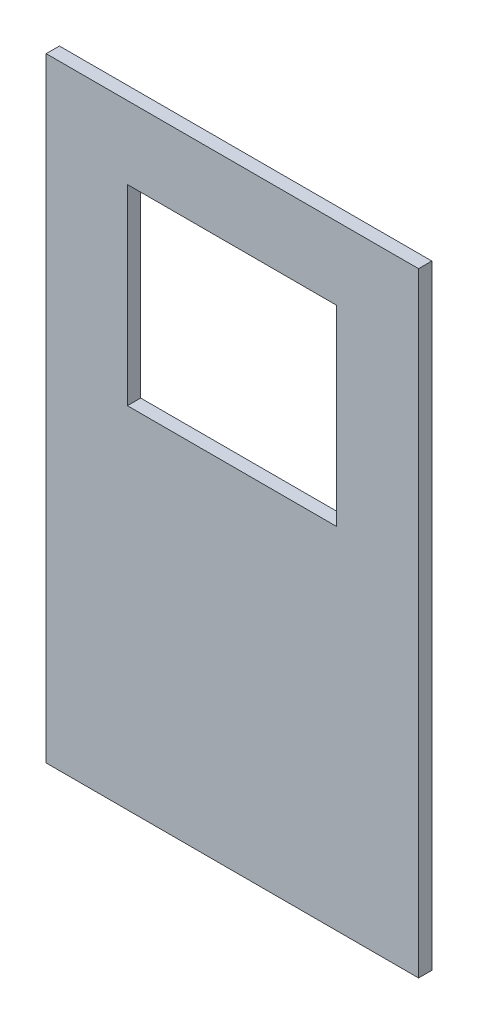
from build123d import *

# Parameters (mm, degrees)
SKETCH1_6_W   = 50.090098238
SKETCH1_6_H   = 45.932062837
SKETCH1_6_R   = 4.5
BEZEL_DEPTH   = 3.18
SKETCH1_7_W   = 89.29
SKETCH1_7_H   = 147.294272307
SKETCH1_7_R   = 3.6
SKETCH1_7_R_2 = 3.5
BODY_DEPTH    = 3.18
SKETCH1_R     = 3.6
SKETCH1_R_2   = 3.5
SKETCH1_R_3   = 4.5
BUTTONS_DEPTH = 3.18


with BuildPart() as part:
    # Sketch1<6> → Bezel (new body)
    with BuildSketch(Plane.XY):
        with BuildLine():
            ThreePointArc((38.389642662, 59.990077479), (37.657409615, 61.757844432), (35.889642662, 62.490077479))
            Line((35.889642662, 62.490077479), (-35.919151108, 62.490077479))
            ThreePointArc((-35.919151108, 62.490077479), (-37.686918061, 61.757844432), (-38.419151108, 59.990077479))
            Line((-38.419151108, 59.990077479), (-38.419151108, 6.918014642))
            ThreePointArc((-38.419151108, 6.918014642), (-37.686918061, 5.150247689), (-35.919151108, 4.418014642))
            Line((-35.919151108, 4.418014642), (29.997375098, 4.418014642))
            ThreePointArc((29.997375098, 4.418014642), (35.990372343, 7.41277043), (38.389642662, 13.668014642))
            Line((38.389642662, 13.668014642), (38.389642662, 59.990077479))
        make_face()
        with Locations((-0.014754223, 33.23404606)):
            Rectangle(SKETCH1_6_W, SKETCH1_6_H, mode=Mode.SUBTRACT)
        with Locations((-32.845865367, 40.325993685)):
            Circle(SKETCH1_6_R, mode=Mode.SUBTRACT)
    extrude(amount=BEZEL_DEPTH)

    # Sketch1<7> → Body (add)
    with BuildSketch(Plane.XY):
        with Locations((0.105848892, -0.017058674)):
            Rectangle(SKETCH1_7_W, SKETCH1_7_H)
        with BuildLine():
            ThreePointArc((-14.641551271, -51.285483428), (-16.940439708, -50.641794665), (-16.296750946, -48.342906228))
            Line((-16.296750946, -48.342906228), (-9.324146649, -44.420816311))
            ThreePointArc((-9.324146649, -44.420816311), (-7.152105158, -45.022980632), (-7.741744524, -47.198455643))
            Line((-7.741744524, -47.198455643), (-14.641551271, -51.285483428))
        make_face(mode=Mode.SUBTRACT)
        with Locations((-26.900831216, -26.517202566)):
            Circle(SKETCH1_7_R, mode=Mode.SUBTRACT)
        with BuildLine():
            ThreePointArc((1.358448729, -51.285483428), (-0.940439708, -50.641794665), (-0.296750946, -48.342906228))
            Line((-0.296750946, -48.342906228), (6.675853351, -44.420816311))
            ThreePointArc((6.675853351, -44.420816311), (8.847894842, -45.022980632), (8.258255476, -47.198455643))
            Line((8.258255476, -47.198455643), (1.358448729, -51.285483428))
        make_face(mode=Mode.SUBTRACT)
        with Locations((18.957561099, -29.561304194)):
            Circle(SKETCH1_7_R_2, mode=Mode.SUBTRACT)
        with Locations((33.068305831, -21.491722051)):
            Circle(SKETCH1_7_R_2, mode=Mode.SUBTRACT)
        with BuildLine():
            Line((-35.919151108, 62.490077479), (35.889642662, 62.490077479))
            ThreePointArc((35.889642662, 62.490077479), (37.657409615, 61.757844432), (38.389642662, 59.990077479))
            Line((38.389642662, 59.990077479), (38.389642662, 13.668014642))
            ThreePointArc((38.389642662, 13.668014642), (35.990372343, 7.41277043), (29.997375098, 4.418014642))
            Line((29.997375098, 4.418014642), (-35.919151108, 4.418014642))
            ThreePointArc((-35.919151108, 4.418014642), (-37.686918061, 5.150247689), (-38.419151108, 6.918014642))
            Line((-38.419151108, 6.918014642), (-38.419151108, 59.990077479))
            ThreePointArc((-38.419151108, 59.990077479), (-37.686918061, 61.757844432), (-35.919151108, 62.490077479))
        make_face(mode=Mode.SUBTRACT)
    extrude(amount=BODY_DEPTH)

    # Sketch1 → Buttons (add)
    with BuildSketch(Plane.XY):
        with BuildLine():
            Line((6.675853351, -44.420816311), (-0.296750946, -48.342906228))
            ThreePointArc((-0.296750946, -48.342906228), (-0.940439708, -50.641794665), (1.358448729, -51.285483428))
            Line((1.358448729, -51.285483428), (8.258255476, -47.198455643))
            ThreePointArc((8.258255476, -47.198455643), (8.847894842, -45.022980632), (6.675853351, -44.420816311))
        make_face()
        with BuildLine():
            Line((-9.324146649, -44.420816311), (-16.296750946, -48.342906228))
            ThreePointArc((-16.296750946, -48.342906228), (-16.940439708, -50.641794665), (-14.641551271, -51.285483428))
            Line((-14.641551271, -51.285483428), (-7.741744524, -47.198455643))
            ThreePointArc((-7.741744524, -47.198455643), (-7.152105158, -45.022980632), (-9.324146649, -44.420816311))
        make_face()
        with Locations((-26.900831216, -26.517202566)):
            Circle(SKETCH1_R)
        with Locations((18.957561099, -29.561304194)):
            Circle(SKETCH1_R_2)
        with Locations((33.068305831, -21.491722051)):
            Circle(SKETCH1_R_2)
        with Locations((-32.845865367, 40.325993685)):
            Circle(SKETCH1_R_3)
    extrude(amount=BUTTONS_DEPTH)


solid = part.part
